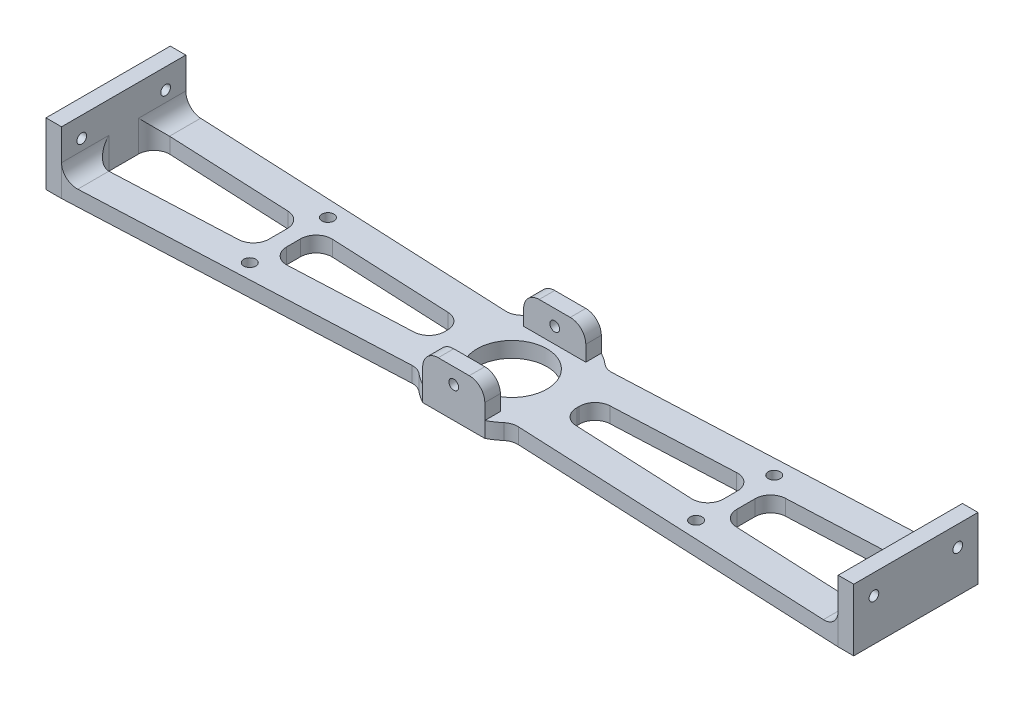
from build123d import *

# Parameters (mm, degrees)
SKETCH1_R                           = 14.2875
BOSS_EXTRUDE1_DEPTH                 = 3.175
SKETCH2_W                           = 6.35
SKETCH2_H                           = 50.8
BOSS_EXTRUDE2_DEPTH                 = 19.05
SKETCH7_W                           = 25.4
SKETCH7_H                           = 6.35
BOSS_EXTRUDE3_DEPTH                 = 12.7
FILLET1_R                           = 6.35
F_10_0_1935_DIAMETER_HOLE1_D        = 4.9149
F_5_32_0_15625_DIAMETER_HOLE1_D     = 3.96875
F_5_32_0_15625_DIAMETER_HOLE1_DEPTH = 6.35
F_5_32_0_15625_DIAMETER_HOLE2_D     = 3.96875


with BuildPart() as part:
    # Sketch1 → Boss-Extrude1 (new, symmetric)
    with BuildSketch(Plane(origin=(0, 0, 0), x_dir=(1, 0, 0), z_dir=(0, 1, 0))):
        with BuildLine():
            ThreePointArc((-19.116031394, -19.05), (-16.085251474, -21.670021718), (-12.7, -23.8125))
            Line((-12.7, -23.8125), (12.7, -23.8125))
            ThreePointArc((12.7, -23.8125), (16.085251474, -21.670021718), (19.116031394, -19.05))
            Line((19.116031394, -19.05), (158.75, -25.4))
            Line((158.75, -25.4), (165.1, -25.4))
            Line((165.1, -25.4), (165.1, 25.4))
            Line((165.1, 25.4), (158.75, 25.4))
            Line((158.75, 25.4), (19.116031394, 19.05))
            ThreePointArc((19.116031394, 19.05), (16.085251474, 21.670021718), (12.7, 23.8125))
            Line((12.7, 23.8125), (-12.7, 23.8125))
            ThreePointArc((-12.7, 23.8125), (-16.085251474, 21.670021718), (-19.116031394, 19.05))
            Line((-19.116031394, 19.05), (-158.75, 25.4))
            Line((-158.75, 25.4), (-165.1, 25.4))
            Line((-165.1, 25.4), (-165.1, -25.4))
            Line((-165.1, -25.4), (-158.75, -25.4))
            Line((-158.75, -25.4), (-19.116031394, -19.05))
        make_face()
        Polygon((-158.75, 12.686874536), (-95.626798508, 9.816281274), (-95.626798508, -9.816281274), (-158.75, -12.686874536), align=None, mode=Mode.SUBTRACT)
        with BuildLine():
            Line((-89.276798508, 9.527508417), (-26.153597016, 6.656915155))
            ThreePointArc((-26.153597016, 6.656915155), (-26.9875, 0), (-26.153597016, -6.656915155))
            Line((-26.153597016, -6.656915155), (-89.276798508, -9.527508417))
            Line((-89.276798508, -9.527508417), (-89.276798508, 9.527508417))
        make_face(mode=Mode.SUBTRACT)
        with BuildLine():
            ThreePointArc((26.153597016, -6.656915155), (26.9875, 0), (26.153597016, 6.656915155))
            Line((26.153597016, 6.656915155), (89.276798508, 9.527508417))
            Line((89.276798508, 9.527508417), (89.276798508, -9.527508417))
            Line((89.276798508, -9.527508417), (26.153597016, -6.656915155))
        make_face(mode=Mode.SUBTRACT)
        Polygon((95.626798508, -9.816281274), (95.626798508, 9.816281274), (158.75, 12.686874536), (158.75, -12.686874536), align=None, mode=Mode.SUBTRACT)
        with Locations(Location((0, 0, 0), (0, 0, 270))):
            Circle(SKETCH1_R, mode=Mode.SUBTRACT)
    extrude(amount=BOSS_EXTRUDE1_DEPTH, both=True)

    # Sketch2 → Boss-Extrude2 (add)
    with BuildSketch(Plane(origin=(0, 3.175, 0), x_dir=(1, 0, 0), z_dir=(0, 1, 0))):
        with Locations((-161.925, 0)):
            Rectangle(SKETCH2_W, SKETCH2_H)
        with Locations((161.925, 0)):
            Rectangle(SKETCH2_W, SKETCH2_H)
    extrude(amount=BOSS_EXTRUDE2_DEPTH)

    # Sketch7 → Boss-Extrude3 (add)
    with BuildSketch(Plane(origin=(0, 3.175, 0), x_dir=(1, 0, 0), z_dir=(0, 1, 0))):
        with Locations((0, 20.6375)):
            Rectangle(SKETCH7_W, SKETCH7_H)
        with Locations((0, -20.6375)):
            Rectangle(SKETCH7_W, SKETCH7_H)
    extrude(amount=BOSS_EXTRUDE3_DEPTH)

    # Fillet1
    # the kernel refuses this fillet: 6.35 mm, written as the material it adds along each edge
    with BuildSketch(Plane(origin=(-158.75, 3.175, -3.188125464), x_dir=(1, 0, 0), z_dir=(0, 0, 1))) as fillet1_piece_1_section:
        with BuildLine():
            CenterArc((FILLET1_R, FILLET1_R), FILLET1_R, 180, 90)
            Line((0, FILLET1_R), (0, 0))
            Line((0, 0), (FILLET1_R, 0))
        make_face()
    fillet1_piece_1 = extrude(amount=28.588125464, mode=Mode.PRIVATE)
    fillet1_piece_1 = split(fillet1_piece_1, bisect_by=Plane(origin=(-157.023883404, 4.612578558, 25.321503052), z_dir=(-0.04542908940534357, 0, -0.9989675659578751)), keep=Keep.TOP, mode=Mode.PRIVATE)
    fillet1_piece_1 = split(fillet1_piece_1, bisect_by=Plane(origin=(-157.600832839, 4.612578558, 12.634614964), z_dir=(0.04542908940534378, 0, 0.998967565957875)), keep=Keep.TOP, mode=Mode.PRIVATE)
    add(fillet1_piece_1)
    with BuildSketch(Plane(origin=(158.75, 3.175, -25.4), x_dir=(-1, 0, 0), z_dir=(0, 0, 1))) as fillet1_piece_2_section:
        with BuildLine():
            CenterArc((FILLET1_R, -FILLET1_R), FILLET1_R, 90, 90)
            Line((0, -FILLET1_R), (0, 0))
            Line((0, 0), (FILLET1_R, 0))
        make_face()
    fillet1_piece_2 = extrude(amount=28.588125464, mode=Mode.PRIVATE)
    fillet1_piece_2 = split(fillet1_piece_2, bisect_by=Plane(origin=(157.023883404, 4.612578558, -25.321503052), z_dir=(0.04542908940534357, 0, 0.9989675659578751)), keep=Keep.TOP, mode=Mode.PRIVATE)
    fillet1_piece_2 = split(fillet1_piece_2, bisect_by=Plane(origin=(157.600832839, 4.612578558, -12.634614964), z_dir=(-0.04542908940534328, 0, -0.9989675659578751)), keep=Keep.TOP, mode=Mode.PRIVATE)
    add(fillet1_piece_2)
    with BuildSketch(Plane(origin=(158.75, 3.175, -3.188125464), x_dir=(-1, 0, 0), z_dir=(0, 0, 1))) as fillet1_piece_3_section:
        with BuildLine():
            CenterArc((FILLET1_R, -FILLET1_R), FILLET1_R, 90, 90)
            Line((0, -FILLET1_R), (0, 0))
            Line((0, 0), (FILLET1_R, 0))
        make_face()
    fillet1_piece_3 = extrude(amount=28.588125464, mode=Mode.PRIVATE)
    fillet1_piece_3 = split(fillet1_piece_3, bisect_by=Plane(origin=(157.600832839, 4.612578558, 12.634614964), z_dir=(-0.04542908940534378, 0, 0.998967565957875)), keep=Keep.TOP, mode=Mode.PRIVATE)
    fillet1_piece_3 = split(fillet1_piece_3, bisect_by=Plane(origin=(157.023883404, 4.612578558, 25.321503052), z_dir=(0.04542908940534357, 0, -0.9989675659578751)), keep=Keep.TOP, mode=Mode.PRIVATE)
    add(fillet1_piece_3)
    with BuildSketch(Plane(origin=(-95.626798508, -3.175, 9.816281274), x_dir=(0, 0, -1), z_dir=(0, 1, 0)), Plane(origin=(-95.626798508, -3.175, -9.816281274), x_dir=(-0.998967565957875, 0, -0.04542908940534381), z_dir=(0, 1, 0)), Plane(origin=(95.626798508, -3.175, -9.816281274), x_dir=(0, 0, 1), z_dir=(0, 1, 0)), Plane(origin=(95.626798508, -3.175, 9.816281274), x_dir=(0.998967565957875, 0, 0.045429089405343306), z_dir=(0, 1, 0))) as fillet1_piece_4:
        with BuildLine():
            CenterArc((FILLET1_R * 0.955557460646, FILLET1_R), FILLET1_R, 182.603791233, 87.396208767)
            Line((-FILLET1_R * 0.0434101053116, FILLET1_R * 0.954570910595), (0, 0))
            Line((0, 0), (FILLET1_R * 0.955557460646, 0))
        make_face()
    extrude(amount=6.35)
    with BuildSketch(Plane(origin=(-158.75, -3.175, -12.686874536), x_dir=(0, 0, 1), z_dir=(0, 1, 0)), Plane(origin=(-158.75, 3.175, 12.686874536), x_dir=(0, 0, -1), z_dir=(0, -1, 0)), Plane(origin=(-89.276798508, 3.175, -9.527508417), x_dir=(0.9989675659578751, 0, 0.04542908940534214), z_dir=(0, -1, 0)), Plane(origin=(-89.276798508, -3.175, 9.527508417), x_dir=(0.998967565957875, 0, -0.045429089405344805), z_dir=(0, 1, 0)), Plane(origin=(158.75, 3.175, 12.686874536), x_dir=(-0.9989675659578751, 0, -0.04542908940534367), z_dir=(0, -1, 0)), Plane(origin=(158.75, -3.175, -12.686874536), x_dir=(-0.9989675659578751, 0, 0.04542908940534313), z_dir=(0, 1, 0)), Plane(origin=(89.276798508, -3.175, 9.527508417), x_dir=(0, 0, -1), z_dir=(0, 1, 0)), Plane(origin=(89.276798508, 3.175, -9.527508417), x_dir=(0, 0, 1), z_dir=(0, -1, 0))) as fillet1_piece_5:
        with BuildLine():
            CenterArc((FILLET1_R * 1.04650954148, FILLET1_R), FILLET1_R, 177.396208767, 92.603791233)
            Line((FILLET1_R * 0.0475419755235, FILLET1_R * 1.04542908941), (0, 0))
            Line((0, 0), (FILLET1_R * 1.04650954148, 0))
        make_face()
    extrude(amount=6.35)
    with BuildSketch(Plane(origin=(-26.153597016, -3.175, -6.656915155), x_dir=(-0.998967565957875, 0, -0.04542908940534309), z_dir=(0, 1, 0)), Plane(origin=(26.153597016, -3.175, 6.656915155), x_dir=(0.998967565957875, 0, 0.04542908940534391), z_dir=(0, 1, 0))) as fillet1_piece_6:
        with BuildLine():
            CenterArc((6.896656029, 6.35), FILLET1_R, 181.526507099, 88.473492901)
            ThreePointArc((0.548909595, 6.180839663), (0.452688718, 3.074591188), (0, 0))
            Line((0, 0), (6.896656029, 0))
        make_face()
    extrude(amount=6.35)
    with BuildSketch(Plane(origin=(-26.153597016, -3.175, 6.656915155), x_dir=(-0.13361976900792855, 0, -0.9910326721810275), z_dir=(0, 1, 0)), Plane(origin=(26.153597016, -3.175, -6.656915155), x_dir=(0.13361976900792732, 0, 0.9910326721810275), z_dir=(0, 1, 0))) as fillet1_piece_7:
        with BuildLine():
            CenterArc((6.935185133, 6.307897554), FILLET1_R, 174.92497584, 88.473492901)
            Line((0.610078906, 6.869619211), (0, 0))
            ThreePointArc((0, 0), (3.102582823, 0.178935397), (6.205165645, 0))
        make_face()
    extrude(amount=6.35)
    with BuildSketch(Plane(origin=(-19.116031394, 3.175, -19.05), x_dir=(-0.9989675659578751, 0, -0.0454290894053416), z_dir=(0, -1, 0)), Plane(origin=(19.116031394, -3.175, -19.05), x_dir=(0.9989675659578751, 0, -0.04542908940534203), z_dir=(0, 1, 0)), Plane(origin=(-19.116031394, -3.175, 19.05), x_dir=(-0.9989675659578751, 0, 0.04542908940534209), z_dir=(0, 1, 0))) as fillet1_piece_8:
        with BuildLine():
            CenterArc((2.633750418, 6.35), FILLET1_R, 227.329641643, 42.670358357)
            ThreePointArc((-1.670148615, 1.681065099), (-0.816614348, 0.858872634), (0, 0))
            Line((0, 0), (2.633750418, 0))
        make_face()
    extrude(amount=6.35)
    with BuildSketch(Plane(origin=(19.116031394, -3.175, 19.05), x_dir=(-0.736299689051418, 0, 0.6766555755351352), z_dir=(0, 1, 0))) as fillet1_piece_9:
        with BuildLine():
            CenterArc((2.648464222, 6.343877247), FILLET1_R, 224.813361283, 42.670358357)
            Line((-1.856266403, 1.868399396), (0, 0))
            ThreePointArc((0, 0), (1.184839257, 0.026021699), (2.369678514, 0))
        make_face()
    extrude(amount=6.35)
    with BuildSketch(Plane(origin=(-158.75, 3.175, -25.4), x_dir=(1, 0, 0), z_dir=(0, 0, 1))) as fillet1_piece_10_section:
        with BuildLine():
            CenterArc((FILLET1_R, FILLET1_R), FILLET1_R, 180, 90)
            Line((0, FILLET1_R), (0, 0))
            Line((0, 0), (FILLET1_R, 0))
        make_face()
    fillet1_piece_10 = extrude(amount=28.588125464, mode=Mode.PRIVATE)
    fillet1_piece_10 = split(fillet1_piece_10, bisect_by=Plane(origin=(-157.023883404, 4.612578558, -25.321503052), z_dir=(-0.04542908940534357, 0, 0.9989675659578751)), keep=Keep.TOP, mode=Mode.PRIVATE)
    fillet1_piece_10 = split(fillet1_piece_10, bisect_by=Plane(origin=(-157.600832839, 4.612578558, -12.634614964), z_dir=(0.04542908940534328, 0, -0.9989675659578751)), keep=Keep.TOP, mode=Mode.PRIVATE)
    add(fillet1_piece_10)
    with BuildSketch(Plane(origin=(-158.75, 3.175, -3.188125464), x_dir=(1, 0, 0), z_dir=(0, 0, 1))) as fillet1_piece_11a_section:
        with BuildLine():
            CenterArc((FILLET1_R, FILLET1_R), FILLET1_R, 180, 90)
            Line((0, FILLET1_R), (0, 0))
            Line((0, 0), (FILLET1_R, 0))
        make_face()
    fillet1_piece_11a = extrude(amount=28.588125464, mode=Mode.PRIVATE)
    fillet1_piece_11a = split(fillet1_piece_11a, bisect_by=Plane(origin=(-156.9590385, 4.615793592, 12.605428699), z_dir=(-0.04542908940534378, 0, -0.998967565957875)), keep=Keep.TOP, mode=Mode.PRIVATE)
    with BuildSketch(Plane(origin=(-158.75, 19.788338971, 12.686874536), x_dir=(0, 0, -1), z_dir=(0, -1, 0))) as fillet1_piece_11b_section:
        with BuildLine():
            CenterArc((FILLET1_R * 1.04650954148, FILLET1_R), FILLET1_R, 177.396208767, 92.603791233)
            Line((FILLET1_R * 0.0475419755235, FILLET1_R * 1.04542908941), (0, 0))
            Line((0, 0), (FILLET1_R * 1.04650954148, 0))
        make_face()
    fillet1_piece_11b = extrude(amount=22.963338971, mode=Mode.PRIVATE)
    fillet1_piece_11b = split(fillet1_piece_11b, bisect_by=Plane(origin=(-157.239045955, 3.175, 11.105646711), z_dir=(0, 1, 0)), keep=Keep.TOP, mode=Mode.PRIVATE)
    fillet1_piece_11 = fillet1_piece_11a & fillet1_piece_11b
    add(fillet1_piece_11)
    with BuildSketch(Plane(origin=(158.75, 3.175, -25.4), x_dir=(-1, 0, 0), z_dir=(0, 0, 1))) as fillet1_piece_12a_section:
        with BuildLine():
            CenterArc((FILLET1_R, -FILLET1_R), FILLET1_R, 90, 90)
            Line((0, -FILLET1_R), (0, 0))
            Line((0, 0), (FILLET1_R, 0))
        make_face()
    fillet1_piece_12a = extrude(amount=28.588125464, mode=Mode.PRIVATE)
    fillet1_piece_12a = split(fillet1_piece_12a, bisect_by=Plane(origin=(156.9590385, 4.615793592, -12.605428699), z_dir=(0.04542908940534328, 0, 0.9989675659578751)), keep=Keep.TOP, mode=Mode.PRIVATE)
    with BuildSketch(Plane(origin=(158.75, -3.175, -12.686874536), x_dir=(-0.9989675659578751, 0, 0.04542908940534313), z_dir=(0, 1, 0))) as fillet1_piece_12b_section:
        with BuildLine():
            CenterArc((FILLET1_R * 1.04650954148, FILLET1_R), FILLET1_R, 177.396208767, 92.603791233)
            Line((FILLET1_R * 0.0475419755235, FILLET1_R * 1.04542908941), (0, 0))
            Line((0, 0), (FILLET1_R * 1.04650954148, 0))
        make_face()
    fillet1_piece_12b = extrude(amount=22.963338971, mode=Mode.PRIVATE)
    fillet1_piece_12b = split(fillet1_piece_12b, bisect_by=Plane(origin=(157.239045955, 3.175, -11.105646711), z_dir=(0, 1, 0)), keep=Keep.TOP, mode=Mode.PRIVATE)
    fillet1_piece_12 = fillet1_piece_12a & fillet1_piece_12b
    add(fillet1_piece_12)
    with BuildSketch(Plane(origin=(158.75, 3.175, -3.188125464), x_dir=(-1, 0, 0), z_dir=(0, 0, 1))) as fillet1_piece_13a_section:
        with BuildLine():
            CenterArc((FILLET1_R, -FILLET1_R), FILLET1_R, 90, 90)
            Line((0, -FILLET1_R), (0, 0))
            Line((0, 0), (FILLET1_R, 0))
        make_face()
    fillet1_piece_13a = extrude(amount=28.588125464, mode=Mode.PRIVATE)
    fillet1_piece_13a = split(fillet1_piece_13a, bisect_by=Plane(origin=(156.9590385, 4.615793592, 12.605428699), z_dir=(0.04542908940534378, 0, -0.998967565957875)), keep=Keep.TOP, mode=Mode.PRIVATE)
    with BuildSketch(Plane(origin=(158.75, 19.788338971, 12.686874536), x_dir=(-0.998967565957875, 0, -0.04542908940534393), z_dir=(0, -1, 0))) as fillet1_piece_13b_section:
        with BuildLine():
            CenterArc((FILLET1_R * 1.04650954148, FILLET1_R), FILLET1_R, 177.396208767, 92.603791233)
            Line((FILLET1_R * 0.0475419755235, FILLET1_R * 1.04542908941), (0, 0))
            Line((0, 0), (FILLET1_R * 1.04650954148, 0))
        make_face()
    fillet1_piece_13b = extrude(amount=22.963338971, mode=Mode.PRIVATE)
    fillet1_piece_13b = split(fillet1_piece_13b, bisect_by=Plane(origin=(157.239045955, 3.175, 11.105646711), z_dir=(0, 1, 0)), keep=Keep.TOP, mode=Mode.PRIVATE)
    fillet1_piece_13 = fillet1_piece_13a & fillet1_piece_13b
    add(fillet1_piece_13)
    with BuildSketch(Plane(origin=(-158.75, 3.175, -25.4), x_dir=(1, 0, 0), z_dir=(0, 0, 1))) as fillet1_piece_14a_section:
        with BuildLine():
            CenterArc((FILLET1_R, FILLET1_R), FILLET1_R, 180, 90)
            Line((0, FILLET1_R), (0, 0))
            Line((0, 0), (FILLET1_R, 0))
        make_face()
    fillet1_piece_14a = extrude(amount=28.588125464, mode=Mode.PRIVATE)
    fillet1_piece_14a = split(fillet1_piece_14a, bisect_by=Plane(origin=(-156.9590385, 4.615793592, -12.605428699), z_dir=(-0.04542908940534328, 0, 0.9989675659578751)), keep=Keep.TOP, mode=Mode.PRIVATE)
    with BuildSketch(Plane(origin=(-158.75, -3.175, -12.686874536), x_dir=(0, 0, 1), z_dir=(0, 1, 0))) as fillet1_piece_14b_section:
        with BuildLine():
            CenterArc((FILLET1_R * 1.04650954148, FILLET1_R), FILLET1_R, 177.396208767, 92.603791233)
            Line((FILLET1_R * 0.0475419755235, FILLET1_R * 1.04542908941), (0, 0))
            Line((0, 0), (FILLET1_R * 1.04650954148, 0))
        make_face()
    fillet1_piece_14b = extrude(amount=22.963338971, mode=Mode.PRIVATE)
    fillet1_piece_14b = split(fillet1_piece_14b, bisect_by=Plane(origin=(-157.239045955, 3.175, -11.105646711), z_dir=(0, 1, 0)), keep=Keep.TOP, mode=Mode.PRIVATE)
    fillet1_piece_14 = fillet1_piece_14a & fillet1_piece_14b
    add(fillet1_piece_14)
    # the kernel refuses this fillet: 6.35 mm, written as the material it takes off along each edge
    with BuildSketch(Plane(origin=(-12.7, 15.875, -1.5875), x_dir=(1, 0, 0), z_dir=(0, 0, -1))) as fillet1_2_piece_1:
        with BuildLine():
            CenterArc((FILLET1_R, FILLET1_R), FILLET1_R, 180, 90)
            Line((0, FILLET1_R), (0, 0))
            Line((0, 0), (FILLET1_R, 0))
        make_face()
    extrude(amount=38.1, mode=Mode.SUBTRACT)
    with BuildSketch(Plane(origin=(12.7, 15.875, -39.6875), x_dir=(0, -1, 0), z_dir=(0, 0, 1)), Plane(origin=(-12.7, 15.875, 1.5875), x_dir=(1, 0, 0), z_dir=(0, 0, 1)), Plane(origin=(12.7, 15.875, 39.6875), x_dir=(-1, 0, 0), z_dir=(0, 0, -1))) as fillet1_2_piece_2:
        with BuildLine():
            CenterArc((FILLET1_R, -FILLET1_R), FILLET1_R, 90, 90)
            Line((0, -FILLET1_R), (0, 0))
            Line((0, 0), (FILLET1_R, 0))
        make_face()
    extrude(amount=38.1, mode=Mode.SUBTRACT)

    # #10 (0.1935) Diameter Hole1 (through all)
    with Locations(Plane(origin=(0, 3.175, 0), x_dir=(1, 0, 0), z_dir=(0, 1, 0))):
        with Locations((-91.226813447, 15.972750107), (-91.226813447, -15.972750107), (91.226813447, 15.972750107), (91.226813447, -15.972750107)):
            Hole(F_10_0_1935_DIAMETER_HOLE1_D / 2)

    # 5/32 (0.15625) Diameter Hole1
    with Locations(Plane(origin=(-158.75, 0, 0), x_dir=(0, 0, -1), z_dir=(1, 0, 0))):
        with Locations((17.145, 13.97), (-17.145, 13.97)):
            f_5_32_0_15625_diameter_hole1 = Hole(F_5_32_0_15625_DIAMETER_HOLE1_D / 2, depth=F_5_32_0_15625_DIAMETER_HOLE1_DEPTH)

    # Mirror1: 5/32 (0.15625) Diameter Hole1 across plane
    add(f_5_32_0_15625_diameter_hole1.mirror(Plane(origin=(0, 0, 0), x_dir=(0, 0, 1), z_dir=(1, 0, 0))), mode=Mode.SUBTRACT)

    # 5/32 (0.15625) Diameter Hole2 (through all)
    with Locations(Plane(origin=(0, 0, -23.8125), x_dir=(-1, 0, 0), z_dir=(0, 0, -1))):
        with Locations((0, 9.525)):
            Hole(F_5_32_0_15625_DIAMETER_HOLE2_D / 2)


solid = part.part
